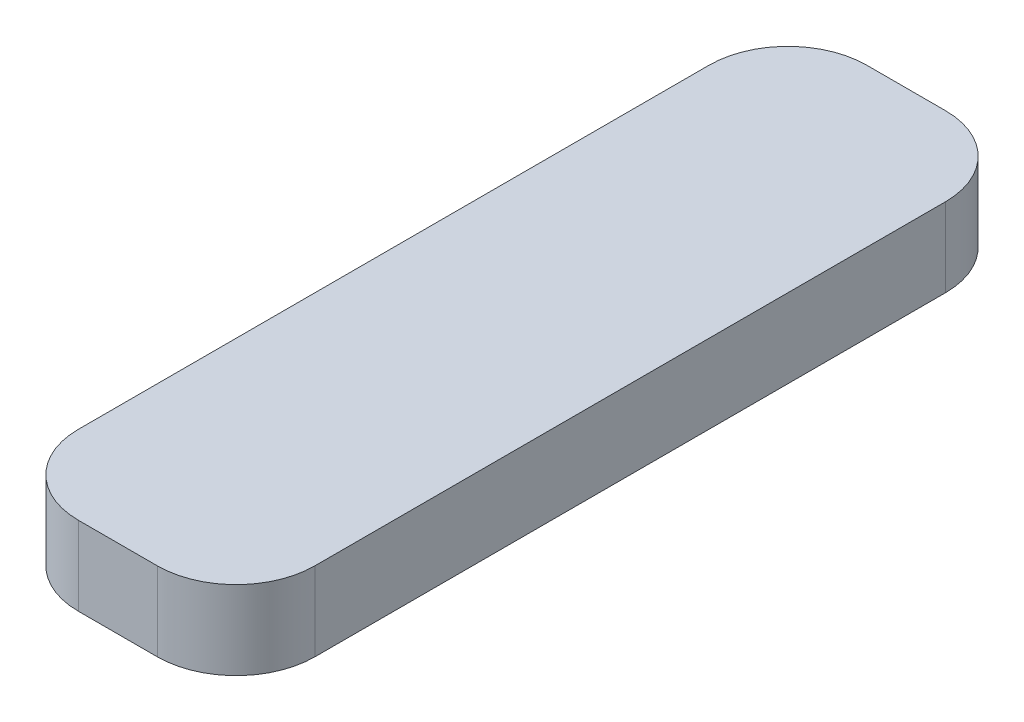
from build123d import *

# Parameters (mm, degrees)
SKETCH1_W           = 30
SKETCH1_H           = 100
BOSS_EXTRUDE1_DEPTH = 10
FILLET1_R           = 10


with BuildPart() as part:
    # Sketch1 → Boss-Extrude1 (new body)
    with BuildSketch(Plane(origin=(0, 0, 0), x_dir=(1, 0, 0), z_dir=(0, 1, 0))):
        with Locations((15, 50)):
            Rectangle(SKETCH1_W, SKETCH1_H)
    extrude(amount=BOSS_EXTRUDE1_DEPTH)

    # Fillet1
    fillet1_edges = [part.edges().sort_by_distance(p)[0] for p in [
        (30, 5, -100),
        (30, 5, 0),
        (0, 5, 0),
        (0, 5, -100),
    ]]
    fillet(fillet1_edges, radius=FILLET1_R)


solid = part.part
